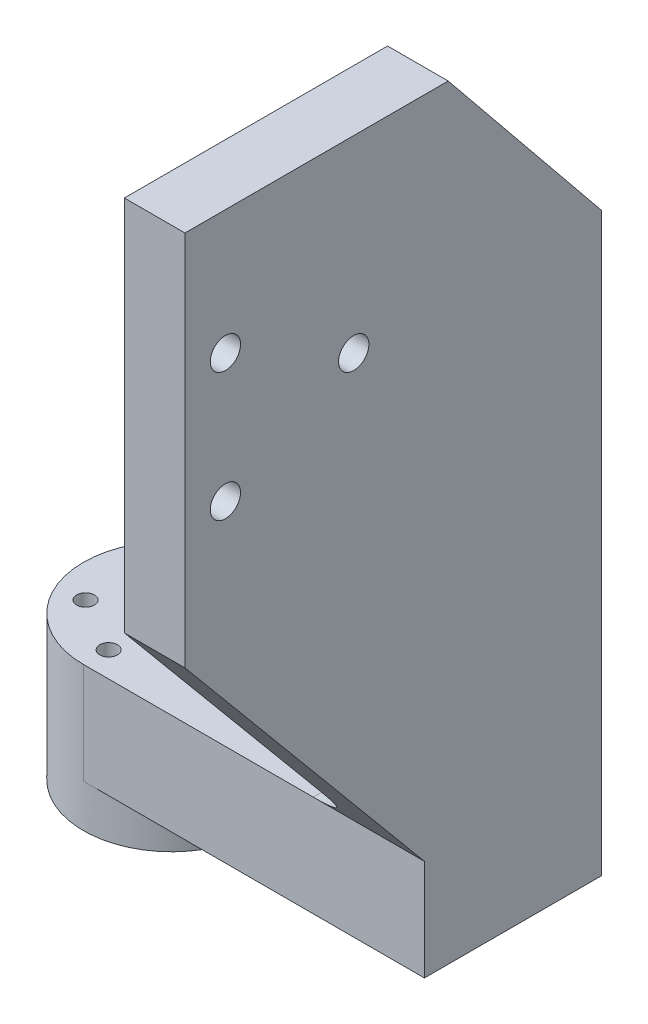
from build123d import *

# Parameters (mm, degrees)
BOSS_EXTRUDE1_DEPTH = 20
BOSS_EXTRUDE2_START = 8.5
SKETCH2_R           = 17.5
BOSS_EXTRUDE2_DEPTH = 8.5
BOSS_EXTRUDE3_DEPTH = 12
SKETCH4_R           = 3
CUT_EXTRUDE1_DEPTH  = 186.350058538
SKETCH5_R           = 1.75
CUT_EXTRUDE2_DEPTH  = 186.288354194
FILLET1_R           = 10


with BuildPart() as part:
    # Sketch1 → Boss-Extrude1 (new body)
    with BuildSketch(Plane(origin=(0, 0, 0), x_dir=(1, 0, 0), z_dir=(0, 1, 0))):
        with BuildLine():
            Line((67.5, 17.5), (0, 17.5))
            ThreePointArc((0, 17.5), (-17.5, 0), (0, -17.5))
            Line((0, -17.5), (67.5, -17.5))
            Line((67.5, -17.5), (67.5, 17.5))
        make_face()
    extrude(amount=BOSS_EXTRUDE1_DEPTH)

    # Sketch2 → Boss-Extrude2 (add)
    with BuildSketch(Plane.XZ.offset(BOSS_EXTRUDE2_START)):
        Circle(SKETCH2_R)
    extrude(amount=-BOSS_EXTRUDE2_DEPTH)

    # Sketch3 → Boss-Extrude3 (add)
    with BuildSketch(Plane(origin=(67.5, 0, 0), x_dir=(0, 0, -1), z_dir=(1, 0, 0))):
        Polygon((-17.5, 0), (17.5, 0), (17.5, 114.118307847), (-12.79, 151.39), (-64.89, 151.39), (-64.89, 76.846615693), (-57.39, 67.85), (-17.5, 20), align=None)
    extrude(amount=-BOSS_EXTRUDE3_DEPTH)

    # Sketch4 → Cut-Extrude1 (cut, through all)
    with BuildSketch(Plane(origin=(67.5, 0, 0), x_dir=(0, 0, -1), z_dir=(1, 0, 0))):
        with Locations((-56.89, 101.418307847)):
            Circle(SKETCH4_R)
        with Locations((-56.89, 126.818307847)):
            Circle(SKETCH4_R)
        with Locations((-31.49, 114.118307847)):
            Circle(SKETCH4_R)
    extrude(amount=-CUT_EXTRUDE1_DEPTH, mode=Mode.SUBTRACT)

    # Sketch5 → Cut-Extrude2 (cut, through all)
    with BuildSketch(Plane.XZ.offset(8.5)):
        with Locations((0, 12.5)):
            Circle(SKETCH5_R)
        with Locations((10.825317547, 6.25)):
            Circle(SKETCH5_R)
        with Locations((10.825317547, -6.25)):
            Circle(SKETCH5_R)
        with Locations((0, -12.5)):
            Circle(SKETCH5_R)
        with Locations((-10.825317547, -6.25)):
            Circle(SKETCH5_R)
        with Locations((-10.825317547, 6.25)):
            Circle(SKETCH5_R)
    extrude(amount=-CUT_EXTRUDE2_DEPTH, mode=Mode.SUBTRACT)

    # Fillet1
    fillet1_edges = [part.edges().sort_by_distance(p)[0] for p in [
        (55.5, 20, 0),
    ]]
    fillet(fillet1_edges, radius=FILLET1_R)


with BuildPart() as body_2:
    # Mirror1: mirrored copy
    add(part.part.mirror(Plane(origin=(-20, 0, 0), x_dir=(0, 0, 1), z_dir=(1, 0, 0))))


solid = part.part
